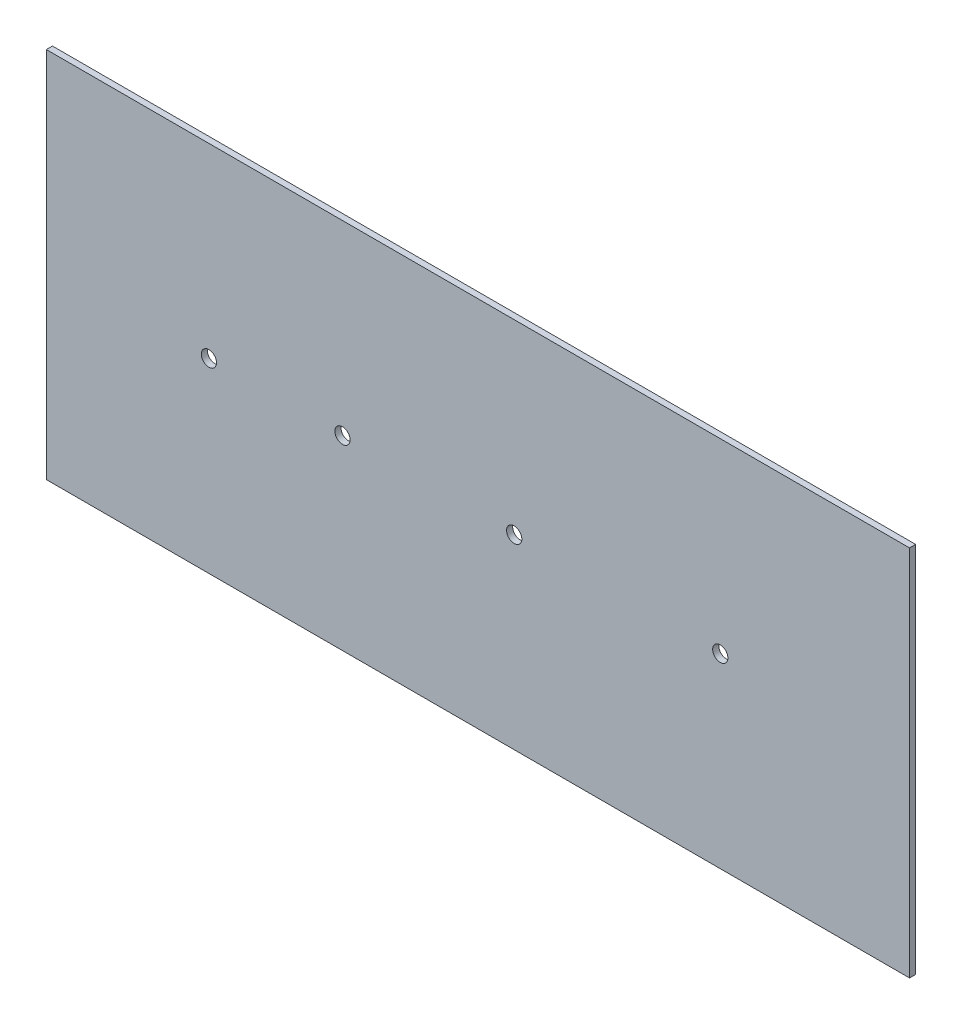
from build123d import *

# Parameters (mm, degrees)
SKETCH_1_W      = 282.75
SKETCH_1_H      = 122
SKETCH_1_R      = 2.5
EXTRUDE_1_DEPTH = 2


with BuildPart() as part:
    # Эскиз1 → Бобышка-Вытянуть1 (new body)
    with BuildSketch(Plane.XY):
        with Locations((141.375, 61)):
            Rectangle(SKETCH_1_W, SKETCH_1_H)
        with Locations((220.75, 61)):
            Circle(SKETCH_1_R, mode=Mode.SUBTRACT)
        with Locations((153.25, 61)):
            Circle(SKETCH_1_R, mode=Mode.SUBTRACT)
        with Locations((97, 61)):
            Circle(SKETCH_1_R, mode=Mode.SUBTRACT)
        with Locations((53.25, 61)):
            Circle(SKETCH_1_R, mode=Mode.SUBTRACT)
    extrude(amount=EXTRUDE_1_DEPTH)


solid = part.part
